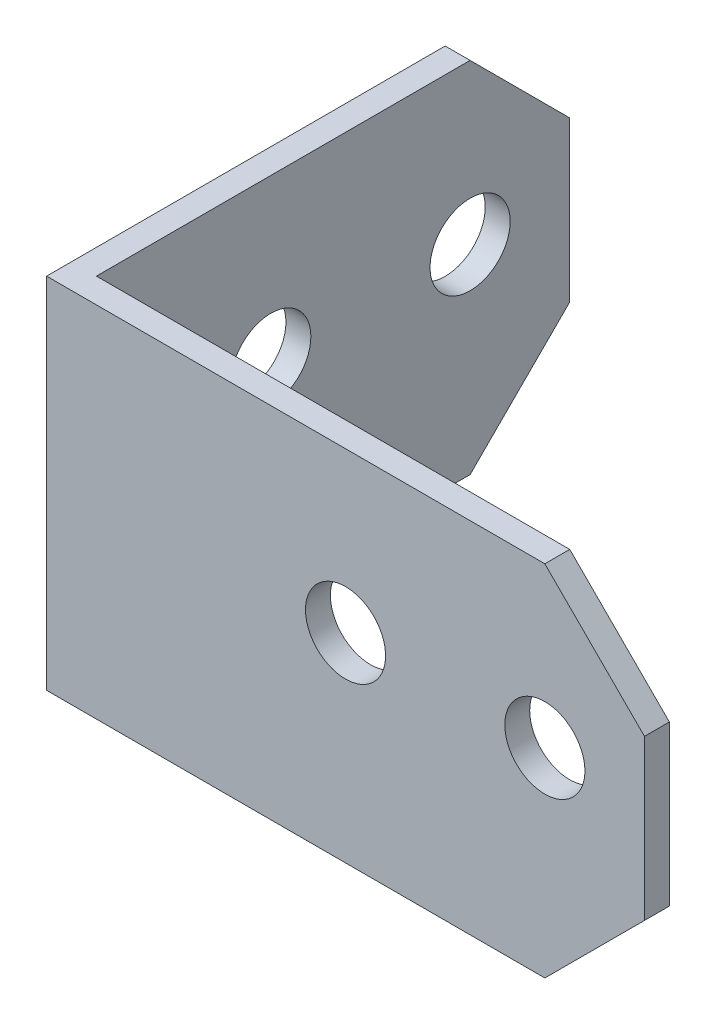
from build123d import *

# Parameters (mm, degrees)
BOSS_EXTRUDE1_DEPTH = 45.72
SKETCH2_R           = 2.5527
CUT_EXTRUDE1_DEPTH  = 59.307156693
SKETCH3_R           = 2.5527
CUT_EXTRUDE2_DEPTH  = 64.762509842
CHAMFER1_SIZE       = 6.35
CUT_EXTRUDE3_DEPTH  = 59.307156693
CUT_EXTRUDE4_DEPTH  = 64.762509842
SKETCH6_W           = 1.5875
SKETCH6_H           = 22.86
CUT_EXTRUDE5_DEPTH  = 60.143982072
CHAMFER2_SIZE       = 6.35


with BuildPart() as part:
    # Sketch1 → Boss-Extrude1 (new body)
    with BuildSketch(Plane(origin=(0, 0, 0), x_dir=(1, 0, 0), z_dir=(0, 1, 0))):
        Polygon((-18.109259259, 25.341203704), (-16.521759259, 25.341203704), (-16.521759259, -4.821296296), (19.990740741, -4.821296296), (19.990740741, -6.408796296), (-18.109259259, -6.408796296), align=None)
    extrude(amount=BOSS_EXTRUDE1_DEPTH)

    # Sketch2 → Cut-Extrude1 (cut, through all)
    with BuildSketch(Plane(origin=(0, 0, 4.821296296), x_dir=(-1, 0, 0), z_dir=(0, 0, -1))):
        with Locations((-0.940740741, 35.56)):
            Circle(SKETCH2_R)
        with Locations((-13.640740741, 35.56)):
            Circle(SKETCH2_R)
        with Locations((-13.640740741, 10.16)):
            Circle(SKETCH2_R)
        with Locations((-0.940740741, 10.16)):
            Circle(SKETCH2_R)
    extrude(amount=-CUT_EXTRUDE1_DEPTH, mode=Mode.SUBTRACT)

    # Sketch3 → Cut-Extrude2 (cut, through all)
    with BuildSketch(Plane(origin=(-16.521759259, 0, 0), x_dir=(0, 0, -1), z_dir=(1, 0, 0))):
        with Locations((6.291203704, 35.56)):
            Circle(SKETCH3_R)
        with Locations((18.991203704, 35.56)):
            Circle(SKETCH3_R)
        with Locations((18.991203704, 10.16)):
            Circle(SKETCH3_R)
        with Locations((6.291203704, 10.16)):
            Circle(SKETCH3_R)
    extrude(amount=-CUT_EXTRUDE2_DEPTH, mode=Mode.SUBTRACT)

    # Chamfer1
    chamfer1_edges = [part.edges().sort_by_distance(p)[0] for p in [
        (19.990740741, 45.72, 5.615046296),
        (19.990740741, 0, 5.615046296),
        (-17.315509259, 0, -25.341203704),
        (-17.315509259, 45.72, -25.341203704),
    ]]
    chamfer(chamfer1_edges, length=CHAMFER1_SIZE)

    # Sketch4 → Cut-Extrude3 (cut, through all)
    with BuildSketch(Plane(origin=(0, 0, 4.821296296), x_dir=(-1, 0, 0), z_dir=(0, 0, -1))):
        Polygon((-19.990740741, 22.86), (16.521759259, 22.86), (16.521759259, 0), (-13.640740741, 0), (-19.990740741, 6.35), align=None)
    extrude(amount=-CUT_EXTRUDE3_DEPTH, mode=Mode.SUBTRACT)

    # Sketch5 → Cut-Extrude4 (cut, through all)
    with BuildSketch(Plane(origin=(-16.521759259, 0, 0), x_dir=(0, 0, -1), z_dir=(1, 0, 0))):
        Polygon((25.341203704, 22.86), (-4.821296296, 22.86), (-4.821296296, 0), (18.991203704, 0), (25.341203704, 6.35), align=None)
    extrude(amount=-CUT_EXTRUDE4_DEPTH, mode=Mode.SUBTRACT)

    # Sketch6 → Cut-Extrude5 (cut, through all)
    with BuildSketch(Plane.XY.offset(6.408796296)):
        with Locations((-17.315509259, 11.43)):
            Rectangle(SKETCH6_W, SKETCH6_H)
    extrude(amount=-CUT_EXTRUDE5_DEPTH, mode=Mode.SUBTRACT)

    # Chamfer2
    chamfer2_edges = [part.edges().sort_by_distance(p)[0] for p in [
        (-17.315509259, 22.86, -25.341203704),
        (19.990740741, 22.86, 5.615046296),
    ]]
    chamfer(chamfer2_edges, length=CHAMFER2_SIZE)


solid = part.part
